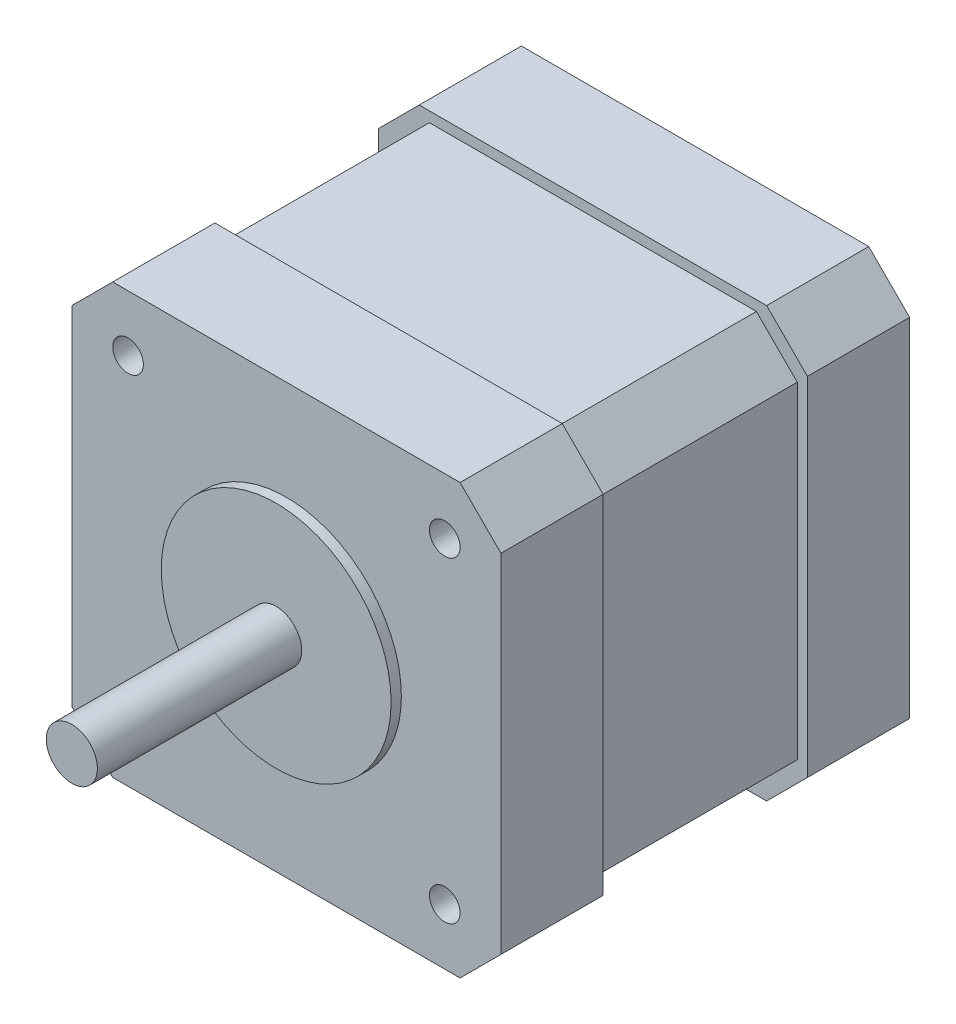
from build123d import *

# Parameters (mm, degrees)
SKETCH1_W           = 42
SKETCH1_H           = 42
BOSS_EXTRUDE1_DEPTH = 10
SKETCH2_W           = 40
SKETCH2_H           = 40
BOSS_EXTRUDE2_DEPTH = 20
SKETCH3_W           = 42
SKETCH3_H           = 42
BOSS_EXTRUDE3_DEPTH = 10
SKETCH4_R           = 11.25
BOSS_EXTRUDE4_DEPTH = 1
CHAMFER1_SIZE       = 4
SKETCH5_R           = 2.5
BOSS_EXTRUDE5_DEPTH = 20
SKETCH6_R           = 1.5
CUT_EXTRUDE1_DEPTH  = 40


with BuildPart() as part:
    # Sketch1 → Boss-Extrude1 (new body)
    with BuildSketch(Plane.XY):
        Rectangle(SKETCH1_W, SKETCH1_H)
    extrude(amount=BOSS_EXTRUDE1_DEPTH)

    # Sketch2 → Boss-Extrude2 (add)
    with BuildSketch(Plane.XY.offset(10)):
        Rectangle(SKETCH2_W, SKETCH2_H)
    extrude(amount=BOSS_EXTRUDE2_DEPTH)

    # Sketch3 → Boss-Extrude3 (add)
    with BuildSketch(Plane.XY.offset(30)):
        Rectangle(SKETCH3_W, SKETCH3_H)
    extrude(amount=BOSS_EXTRUDE3_DEPTH)

    # Sketch4 → Boss-Extrude4 (add)
    with BuildSketch(Plane.XY.offset(40)):
        Circle(SKETCH4_R)
    extrude(amount=BOSS_EXTRUDE4_DEPTH)

    # Chamfer1
    chamfer1_edges = [part.edges().sort_by_distance(p)[0] for p in [
        (-21, -21, 35),
        (-20, -20, 20),
        (-21, -21, 5),
        (21, -21, 35),
        (20, -20, 20),
        (21, -21, 5),
        (21, 21, 35),
        (20, 20, 20),
        (21, 21, 5),
        (-21, 21, 35),
        (-20, 20, 20),
        (-21, 21, 5),
    ]]
    chamfer(chamfer1_edges, length=CHAMFER1_SIZE)

    # Sketch5 → Boss-Extrude5 (add)
    with BuildSketch(Plane.XY.offset(41)):
        Circle(SKETCH5_R)
    extrude(amount=BOSS_EXTRUDE5_DEPTH)

    # Sketch6 → Cut-Extrude1 (cut)
    with BuildSketch(Plane.XY.offset(40)):
        with Locations((-15.5, -15.5)):
            Circle(SKETCH6_R)
        with Locations((-15.5, 15.5)):
            Circle(SKETCH6_R)
        with Locations((15.5, 15.5)):
            Circle(SKETCH6_R)
        with Locations((15.5, -15.5)):
            Circle(SKETCH6_R)
    extrude(amount=-CUT_EXTRUDE1_DEPTH, mode=Mode.SUBTRACT)


solid = part.part
